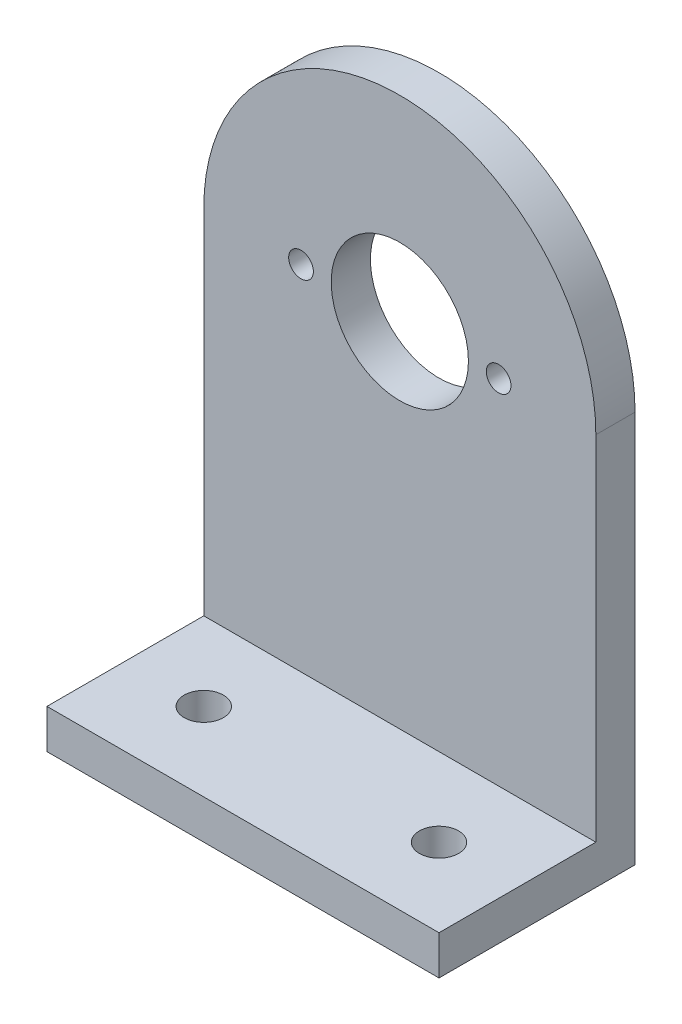
from build123d import *

# Parameters (mm, degrees)
SKETCH1_R                 = 15.875
SKETCH1_W                 = 31.75
SKETCH1_H                 = 31.75
BOSS_EXTRUDE1_DEPTH       = 3.175
SKETCH3_R                 = 5.55625
CUT_EXTRUDE1_DEPTH        = 36.639286609
SKETCH4_W                 = 31.75
SKETCH4_H                 = 3.175
BOSS_EXTRUDE2_DEPTH       = 12.7
SKETCH5_R                 = 1.5875
CUT_EXTRUDE2_DEPTH        = 50.797929174
F_2_0MM_DOWEL_HOLE1_D     = 2
F_2_0MM_DOWEL_HOLE1_DEPTH = 12.7
F_2_0MM_DOWEL_HOLE1_TIP   = 0.600860619


with BuildPart() as part:
    # Sketch1 → Boss-Extrude1 (new body)
    with BuildSketch(Plane.XY):
        Circle(SKETCH1_R)
        with Locations((0, -15.875)):
            Rectangle(SKETCH1_W, SKETCH1_H)
    extrude(amount=BOSS_EXTRUDE1_DEPTH)

    # Sketch3 → Cut-Extrude1 (cut, through all)
    with BuildSketch(Plane.XY.offset(3.175)):
        Circle(SKETCH3_R)
    extrude(amount=-CUT_EXTRUDE1_DEPTH, mode=Mode.SUBTRACT)

    # Sketch4 → Boss-Extrude2 (add)
    with BuildSketch(Plane.XY.offset(3.175)):
        with Locations((0, -30.1625)):
            Rectangle(SKETCH4_W, SKETCH4_H)
    extrude(amount=BOSS_EXTRUDE2_DEPTH)

    # Sketch5 → Cut-Extrude2 (cut, through all)
    with BuildSketch(Plane(origin=(0, -28.575, 0), x_dir=(1, 0, 0), z_dir=(0, 1, 0))):
        with Locations((-9.525, -9.525)):
            Circle(SKETCH5_R)
        with Locations((9.525, -9.525)):
            Circle(SKETCH5_R)
    extrude(amount=-CUT_EXTRUDE2_DEPTH, mode=Mode.SUBTRACT)

    # Ø2.0mm Dowel Hole1
    with Locations(Plane.XY.offset(3.175)):
        with Locations((-8.001, 0), (8.001, 0)):
            Hole(F_2_0MM_DOWEL_HOLE1_D / 2, depth=F_2_0MM_DOWEL_HOLE1_DEPTH)
            with Locations((0, 0, -(F_2_0MM_DOWEL_HOLE1_DEPTH + F_2_0MM_DOWEL_HOLE1_TIP / 2))):  # 118° drill point
                Cone(0, F_2_0MM_DOWEL_HOLE1_D / 2, F_2_0MM_DOWEL_HOLE1_TIP, mode=Mode.SUBTRACT)


solid = part.part
